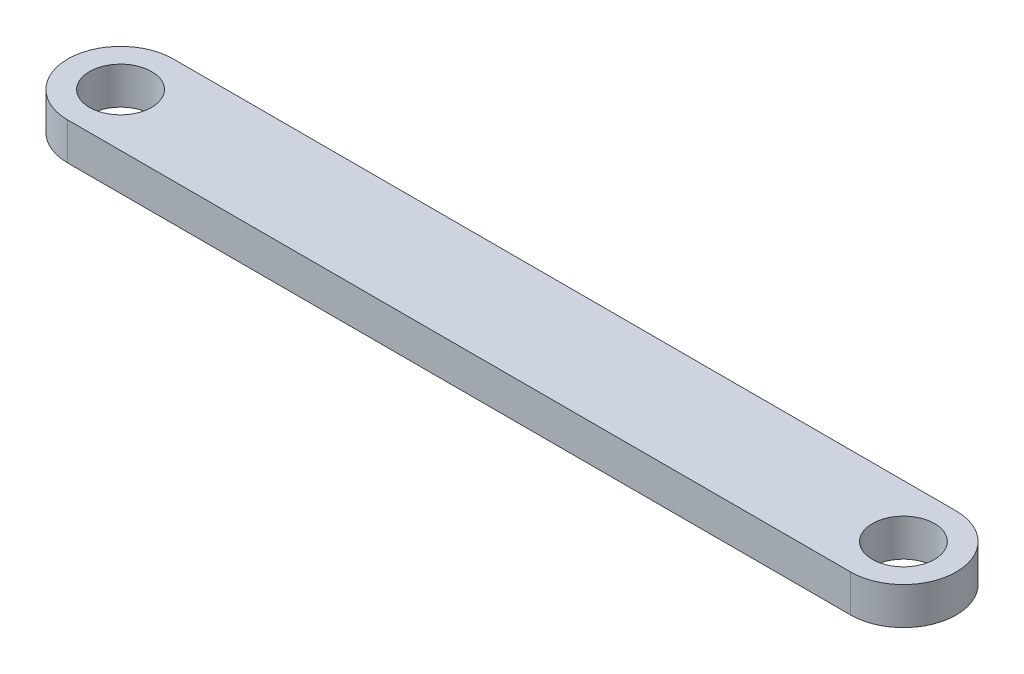
from build123d import *

# Parameters (mm, degrees)
BOSS_EXTRUDE1_DEPTH = 3
SKETCH4_R           = 2.5
CUT_EXTRUDE2_DEPTH  = 68.450908074


with BuildPart() as part:
    # Sketch2 → Boss-Extrude1 (new body)
    with BuildSketch(Plane(origin=(0, 0, 0), x_dir=(1, 0, 0), z_dir=(0, 1, 0))):
        with BuildLine():
            Line((0, -4.25), (63, -4.25))
            ThreePointArc((63, -4.25), (67.25, 0), (63, 4.25))
            Line((63, 4.25), (0, 4.25))
            ThreePointArc((0, 4.25), (-4.25, 0), (0, -4.25))
        make_face()
    extrude(amount=BOSS_EXTRUDE1_DEPTH)

    # Sketch4 → Cut-Extrude2 (cut, through all)
    with BuildSketch(Plane(origin=(0, 3, 0), x_dir=(1, 0, 0), z_dir=(0, 1, 0))):
        Circle(SKETCH4_R)
        with Locations((63, 0)):
            Circle(SKETCH4_R)
    extrude(amount=-CUT_EXTRUDE2_DEPTH, mode=Mode.SUBTRACT)


solid = part.part
